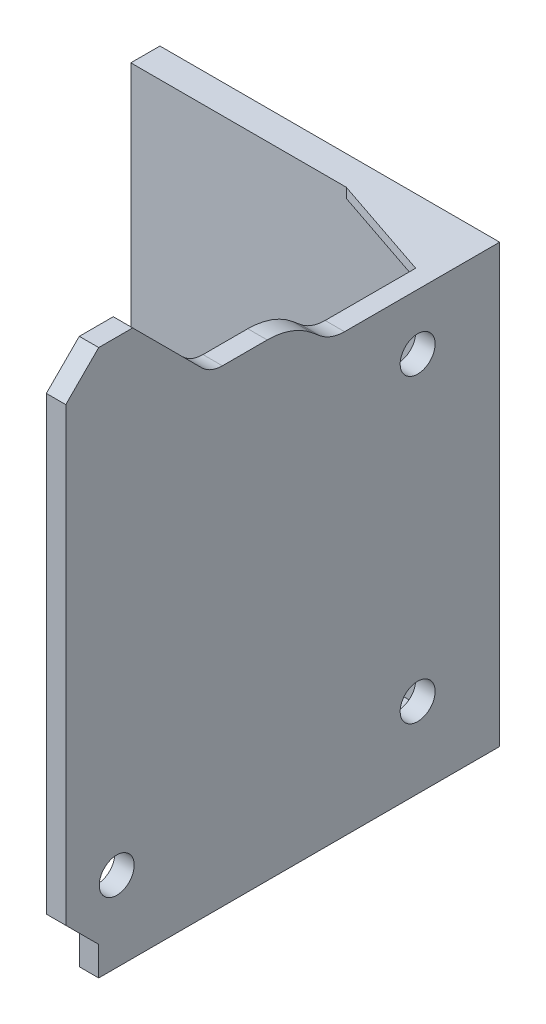
from build123d import *

# Parameters (mm, degrees)
SKETCH1_R                = 1.8
BOSS_EXTRUDE1_DEPTH      = 2
BOSS_EXTRUDE2_DEPTH      = 33
BOSS_EXTRUDE3_DEPTH      = 1
CHAMFER1_START           = 78.15897378
CHAMFER1_DEPTH           = 1.443375673
BOSS_EXTRUDE4_DEPTH      = 3
BOSS_EXTRUDE4_DEPTH_BACK = 0.0001
BOSS_EXTRUDE5_DEPTH      = 2.5
CUT_EXTRUDE1_DEPTH       = 3.0001


with BuildPart() as part:
    # Sketch1 → Boss-Extrude1 (new body)
    with BuildSketch(Plane(origin=(34.895003496, 0, 0), x_dir=(0, 0, -1), z_dir=(1, 0, 0))):
        with BuildLine():
            Line((-197.649446246, 296.929756404), (-189.949446246, 296.929756404))
            Line((-189.949446246, 296.929756404), (-189.949446246, 254.929756404))
            Line((-189.949446246, 254.929756404), (-196.543558796, 254.929756404))
            Line((-196.543558796, 254.929756404), (-231.255333696, 254.929756404))
            Line((-231.255333696, 254.929756404), (-234.649446246, 258.323868954))
            Line((-234.649446246, 258.323868954), (-234.649446246, 304.785643855))
            Line((-234.649446246, 304.785643855), (-231.255333696, 308.179756404))
            Line((-231.255333696, 308.179756404), (-227.755333696, 308.179756404))
            Line((-227.755333696, 308.179756404), (-224.361221147, 304.785643855))
            Line((-224.361221147, 304.785643855), (-220.634013353, 301.058436061))
            ThreePointArc((-220.634013353, 301.058436061), (-219.660743306, 300.408117807), (-218.512693009, 300.179756404))
            Line((-218.512693009, 300.179756404), (-213.899446246, 300.179756404))
            ThreePointArc((-213.899446246, 300.179756404), (-211.430377525, 299.74636844), (-209.256499056, 298.498018377))
            Line((-209.256499056, 298.498018377), (-208.488462922, 297.857611868))
            ThreePointArc((-208.488462922, 297.857611868), (-207.289081698, 297.168867005), (-205.926836886, 296.929756404))
            Line((-205.926836886, 296.929756404), (-197.649446246, 296.929756404))
        make_face()
        with Locations(Location((-198.399446246, 291.179756404, 0), (0, 0, 90))):
            Circle(SKETCH1_R, mode=Mode.SUBTRACT)
        with Locations(Location((-198.399446246, 260.179756404, 0), (0, 0, 90))):
            Circle(SKETCH1_R, mode=Mode.SUBTRACT)
        with Locations(Location((-229.399446246, 260.179756404, 0), (0, 0, 90))):
            Circle(SKETCH1_R, mode=Mode.SUBTRACT)
    extrude(amount=BOSS_EXTRUDE1_DEPTH)

    # Sketch2 → Boss-Extrude2 (add)
    with BuildSketch(Plane.ZY.offset(-34.895003496)):
        Polygon((192.949446246, 296.929756404), (192.949446246, 255.737509851), (192.949446246, 254.929756404), (189.949446246, 254.929756404), (189.949446246, 296.929756404), align=None)
    extrude(amount=BOSS_EXTRUDE2_DEPTH)

    # Sketch3 → Boss-Extrude3 (add)
    with BuildSketch(Plane(origin=(0, 296.929756404, 0), x_dir=(1, 0, 0), z_dir=(0, 1, 0))):
        Polygon((24.09465277, -192.949446246), (34.895003496, -196.599446246), (34.895003496, -192.949446246), align=None)
    extrude(amount=-BOSS_EXTRUDE3_DEPTH)

    # Chamfer1: read off the stored shape, not the designer's step
    # Chamfer1 outline → Chamfer1 (add)
    with BuildSketch(Plane(origin=(0, 0, 0), x_dir=(0.8164965809277265, -0.4082482904638619, 0.4082482904638633), z_dir=(0.5773502691896251, 0.5773502691896252, -0.5773502691896272)).offset(CHAMFER1_START)):
        Polygon((-15.59112598, -345.689799375), (-12.529263801, -347.457566328), (-12.529263801, -343.922032422), align=None)
    extrude(amount=CHAMFER1_DEPTH)

    # Sketch4 → Boss-Extrude4 (add, two sides: drawn at the far end of the back side and taken through both)
    with BuildSketch(Plane.XZ.offset(-254.929756404).offset(-BOSS_EXTRUDE4_DEPTH_BACK)):
        Polygon((1.895003496, 192.949446246), (34.895003496, 192.949446246), (34.895003496, 231.255333696), (36.895003496, 231.255333696), (36.895003496, 189.949446246), (1.895003496, 170.0501531), align=None)
    extrude(amount=BOSS_EXTRUDE4_DEPTH + BOSS_EXTRUDE4_DEPTH_BACK)

    # Sketch5 → Boss-Extrude5 (add)
    with BuildSketch(Plane.XZ.offset(-251.929756404)):
        Polygon((11.795887964, 192.949446246), (34.895003496, 212.102389971), (34.895003496, 192.949446246), align=None)
    extrude(amount=-BOSS_EXTRUDE5_DEPTH)

    # Sketch6 → Cut-Extrude1 (cut)
    with BuildSketch(Plane(origin=(0, 254.929856404, 0), x_dir=(1, 0, 0), z_dir=(0, 1, 0))):
        Polygon((1.895003496, -189.949446246), (36.895003496, -189.949446246), (1.895003496, -170.0501531), align=None)
    extrude(amount=-CUT_EXTRUDE1_DEPTH, mode=Mode.SUBTRACT)


solid = part.part
